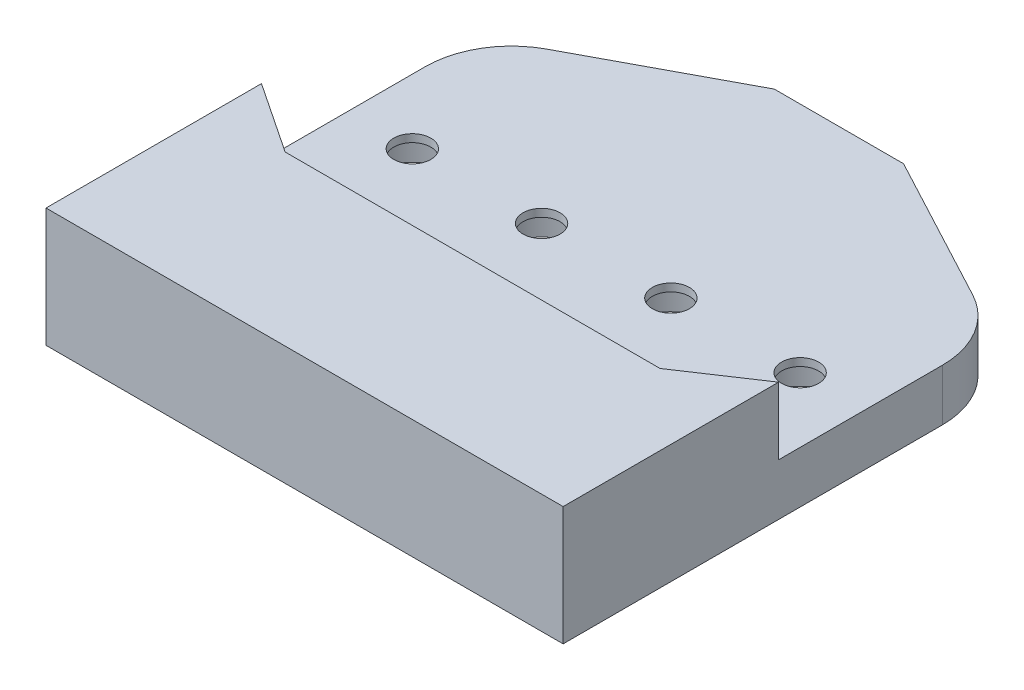
from build123d import *

# Parameters (mm, degrees)
SKETCH2_R           = 2.15
BOSS_EXTRUDE1_DEPTH = 6
BOSS_EXTRUDE2_DEPTH = 7.8
SKETCH5_R           = 6.55
CUT_EXTRUDE2_DEPTH  = 5.1
FILLET1_R           = 10
SKETCH7_W           = 60
SKETCH7_H           = 13.8
BOSS_EXTRUDE3_DEPTH = 15


with BuildPart() as part:
    # Sketch2 → Boss-Extrude1 (new body)
    with BuildSketch(Plane(origin=(0, 0, 0), x_dir=(1, 0, 0), z_dir=(0, 1, 0))):
        Polygon((0, 0), (0, 35), (22.5, 47), (37.5, 47), (60, 35), (60, 0), align=None)
        with Locations((7.5, 20)):
            Circle(SKETCH2_R, mode=Mode.SUBTRACT)
        with Locations((22.5, 20)):
            Circle(SKETCH2_R, mode=Mode.SUBTRACT)
        with Locations((37.5, 20)):
            Circle(SKETCH2_R, mode=Mode.SUBTRACT)
        with Locations((52.5, 20)):
            Circle(SKETCH2_R, mode=Mode.SUBTRACT)
    extrude(amount=BOSS_EXTRUDE1_DEPTH)

    # Sketch3 → Boss-Extrude2 (add)
    with BuildSketch(Plane(origin=(0, 6, 0), x_dir=(1, 0, 0), z_dir=(0, 1, 0))):
        Polygon((0, 10), (0, 0), (60, 0), (60, 10), (51.75, 4.5), (8.25, 4.5), align=None)
    extrude(amount=BOSS_EXTRUDE2_DEPTH)

    # Sketch5 → Cut-Extrude2 (cut)
    with BuildSketch(Plane(origin=(0, 0, 0), x_dir=(1, 0, 0), z_dir=(0, 1, 0))):
        with Locations((7.5, 20)):
            Circle(SKETCH5_R)
        with Locations((22.5, 20)):
            Circle(SKETCH5_R)
        with Locations((37.5, 20)):
            Circle(SKETCH5_R)
        with Locations((52.5, 20)):
            Circle(SKETCH5_R)
    extrude(amount=CUT_EXTRUDE2_DEPTH, mode=Mode.SUBTRACT)

    # Fillet1
    fillet1_edges = [part.edges().sort_by_distance(p)[0] for p in [
        (0, 3, -35),
        (60, 3, -35),
    ]]
    fillet(fillet1_edges, radius=FILLET1_R)

    # Sketch7 → Boss-Extrude3 (add)
    with BuildSketch(Plane.XY):
        with Locations((30, 6.9)):
            Rectangle(SKETCH7_W, SKETCH7_H)
    extrude(amount=BOSS_EXTRUDE3_DEPTH)


solid = part.part
